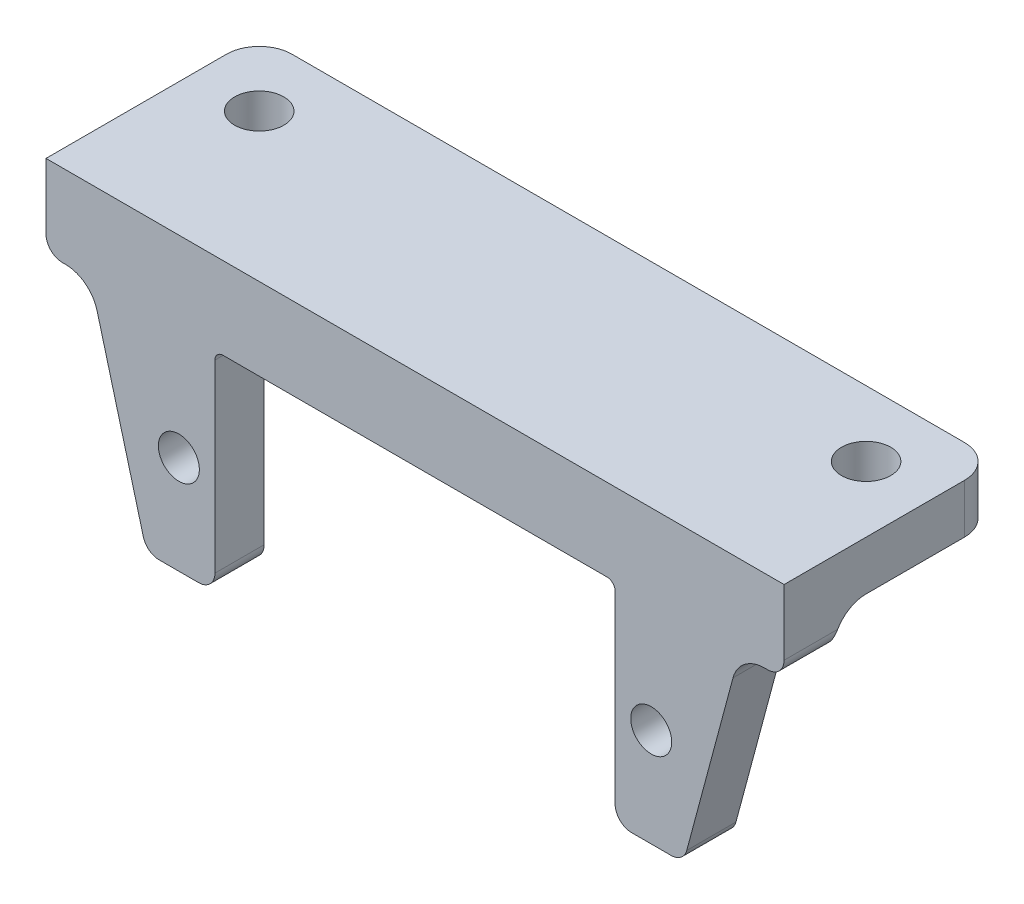
from build123d import *

# Parameters (mm, degrees)
SKETCH3_R           = 1.25
BOSS_EXTRUDE1_DEPTH = 3
SKETCH4_W           = 45
SKETCH4_H           = 3
BOSS_EXTRUDE2_DEPTH = 10
FILLET1_R           = 2
FILLET2_R           = 2
SKETCH5_R           = 1.5
CUT_EXTRUDE1_DEPTH  = 29.702134145


with BuildPart() as part:
    # Sketch3 → Boss-Extrude1 (new body)
    with BuildSketch(Plane.XY):
        with BuildLine():
            Line((-12.2, 6.25), (-12.2, -5))
            ThreePointArc((-12.2, -5), (-12.492893219, -5.707106781), (-13.2, -6))
            Line((-13.2, -6), (-15.6, -6))
            ThreePointArc((-15.6, -6), (-16.208761429, -5.79335334), (-16.565925826, -5.258819045))
            Line((-16.565925826, -5.258819045), (-19.386481515, 5.26763809))
            ThreePointArc((-19.386481515, 5.26763809), (-20.100810309, 6.336706681), (-21.318333167, 6.75))
            Line((-21.318333167, 6.75), (-21.5, 6.75))
            ThreePointArc((-21.5, 6.75), (-22.207106781, 7.042893219), (-22.5, 7.75))
            Line((-22.5, 7.75), (-22.5, 11.75))
            Line((-22.5, 11.75), (22.5, 11.75))
            Line((22.5, 11.75), (22.5, 7.75))
            ThreePointArc((22.5, 7.75), (22.207106781, 7.042893219), (21.5, 6.75))
            Line((21.5, 6.75), (21.318333167, 6.75))
            ThreePointArc((21.318333167, 6.75), (20.100810309, 6.336706681), (19.386481515, 5.26763809))
            Line((19.386481515, 5.26763809), (16.565925826, -5.258819045))
            ThreePointArc((16.565925826, -5.258819045), (16.208761429, -5.79335334), (15.6, -6))
            Line((15.6, -6), (13.2, -6))
            ThreePointArc((13.2, -6), (12.492893219, -5.707106781), (12.2, -5))
            Line((12.2, -5), (12.2, 6.25))
            ThreePointArc((12.2, 6.25), (12.053553391, 6.603553391), (11.7, 6.75))
            Line((11.7, 6.75), (-11.7, 6.75))
            ThreePointArc((-11.7, 6.75), (-12.053553391, 6.603553391), (-12.2, 6.25))
        make_face()
        with Locations((-14.4, 0)):
            Circle(SKETCH3_R, mode=Mode.SUBTRACT)
        with Locations((14.4, 0)):
            Circle(SKETCH3_R, mode=Mode.SUBTRACT)
    extrude(amount=BOSS_EXTRUDE1_DEPTH)

    # Sketch4 → Boss-Extrude2 (add)
    with BuildSketch(Plane(origin=(0, 0, 0), x_dir=(-1, 0, 0), z_dir=(0, 0, -1))):
        with Locations((0, 10.25)):
            Rectangle(SKETCH4_W, SKETCH4_H)
    extrude(amount=BOSS_EXTRUDE2_DEPTH)

    # Fillet1
    fillet1_edges = [part.edges().sort_by_distance(p)[0] for p in [
        (0, 8.75, 0),
    ]]
    fillet(fillet1_edges, radius=FILLET1_R - 0.0001)  # a hair under: the kernel refuses the full size

    # Fillet2
    fillet2_edges = [part.edges().sort_by_distance(p)[0] for p in [
        (22.5, 10.25, -10),
        (-22.5, 10.25, -10),
    ]]
    fillet(fillet2_edges, radius=FILLET2_R)

    # Sketch5 → Cut-Extrude1 (cut, through all)
    with BuildSketch(Plane.XZ.offset(-8.75)):
        with Locations(Location((-18.5, -6, 0), (0, 0, 270))):
            Circle(SKETCH5_R)
    cut_extrude1 = extrude(amount=-CUT_EXTRUDE1_DEPTH, mode=Mode.SUBTRACT)

    # Mirror1: Cut-Extrude1 across plane
    add(cut_extrude1.mirror(Plane(origin=(0, 0, 0), x_dir=(0, 0, 1), z_dir=(1, 0, 0))), mode=Mode.SUBTRACT)


solid = part.part
